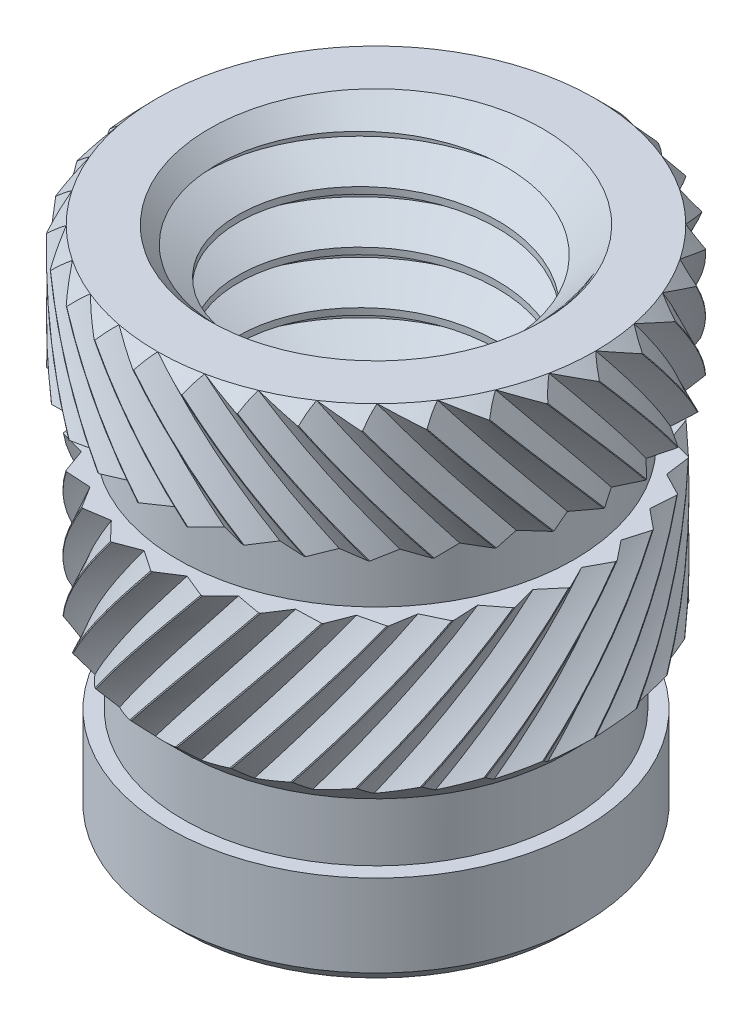
from build123d import *

# Parameters (mm, degrees)
SWEEP1_PITCH           = 0.8
SWEEP1_HEIGHT          = 8.674
SWEEP1_RADIUS          = 2.5
SWEEP1_START_ANGLE     = 90
SPLIT1_SURFACE_1_BACK  = 13.773
SPLIT1_SURFACE_1_DEPTH = 27.546
SPLIT1_SURFACE_2_BACK  = 13.773
SPLIT1_SURFACE_2_DEPTH = 27.546
CUT_SWEEP1_PITCH       = 25.9842
CIRPATTERN1_COUNT      = 30
CUT_SWEEP2_PITCH       = 25.9842
CIRPATTERN2_COUNT      = 32


with BuildPart() as part:
    # Sketch2 → Revolve1 (revolve)
    with BuildSketch(Plane.XY):
        Polygon((2.5, 3.937), (3.556, 3.937), (3.556, 2.00787), (3.0226, 2.00787), (3.0226, 1.02362), (3.3782, 1.02362), (3.3782, -1.12963325), (2.93303325, -1.5748), (2.93303325, -2.460625), (3.1623, -2.460625), (3.1623, -3.71554375), (2.94084375, -3.937), (2.5, -3.937), align=None)
    revolve(axis=Axis((0, -3.937, 0), (0, 1, 0)))

    # Sketch14 → Cut-Revolve2 (revolve, cut)
    with BuildSketch(Plane.XY):
        Polygon((3.34264, 3.937), (3.76936, 3.937), (3.556, 3.72364), align=None)
    revolve(axis=Axis((0, -3.937, 0), (0, 1, 0)), mode=Mode.SUBTRACT)

    # Sweep1: sweep along a helix
    with BuildLine() as sweep1_path:
        add(Helix(SWEEP1_PITCH, SWEEP1_HEIGHT, SWEEP1_RADIUS, center=(0, 3.937, 0), direction=(0, -1, 0), mode=Mode.PRIVATE).rotate(Axis((0, 3.937, 0), (0, -1, 0)), SWEEP1_START_ANGLE))
    # Sketch5 → Sweep1 (sweep)
    with BuildSketch(Plane.XY):
        Polygon((1.980384758, 4.237), (1.980384758, 4.337), (2.54330127, 4.662), (2.54330127, 3.912), align=None)
    sweep(path=sweep1_path.line, is_frenet=True)

    # Sketch6 → Cut-Revolve1 (revolve, cut)
    with BuildSketch(Plane.XY, mode=Mode.PRIVATE) as cut_revolve1_sk:
        Polygon((2.58660254, 4.687), (2.58660254, 3.937), (2.54330127, 3.937), (1.893782217, 3.287480947), (1.893782217, 4.687), align=None)
        Polygon((1.893782217, -3.287480947), (1.893782217, -4.687), (1.893782217, -5.537), (2.58660254, -5.537), (2.58660254, -4.687), (2.58660254, -3.937), (2.54330127, -3.937), align=None)
    revolve(cut_revolve1_sk.sketch.rotate(Axis((0, 3.937, 0), (0, -1, 0)), 292.061472807), axis=Axis((0, 3.937, 0), (0, -1, 0)), mode=Mode.SUBTRACT)


with BuildPart() as body_2:
    # Split1: the piece behind the surface
    add(part.part)
    # Split1 surface: a surface, the sketch's curves swept straight by 27.546 mm
    with BuildLine(Plane.XY.offset(-SPLIT1_SURFACE_1_BACK), mode=Mode.PRIVATE) as split1_surface_1_path:
        Line((-3.556, -1.5748), (3.556, -1.5748))
    split1_surface_1 = Shell.extrude(split1_surface_1_path.wire(), (0 * SPLIT1_SURFACE_1_DEPTH, 0 * SPLIT1_SURFACE_1_DEPTH, 1 * SPLIT1_SURFACE_1_DEPTH))
    split(bisect_by=split1_surface_1, keep=Keep.BOTTOM)


with BuildPart() as part_1:
    add(part.part)

    # Split1: split by a surface, the side it looks to stays
    # Split1 surface: a surface, the sketch's curves swept straight by 27.546 mm
    with BuildLine(Plane.XY.offset(-SPLIT1_SURFACE_2_BACK), mode=Mode.PRIVATE) as split1_surface_2_path:
        Line((-3.556, -1.5748), (3.556, -1.5748))
    split1_surface_2 = Shell.extrude(split1_surface_2_path.wire(), (0 * SPLIT1_SURFACE_2_DEPTH, 0 * SPLIT1_SURFACE_2_DEPTH, 1 * SPLIT1_SURFACE_2_DEPTH))
    split(bisect_by=split1_surface_2, keep=Keep.TOP)

    # Cut-Sweep1: arcs per turn and ends read off the stored shape
    # Cut-Sweep1: the profile of Sketch9 screwed along a right-hand helix through 0.2 turns, 22 arcs to a turn; built about Z, then put on its axis
    cut_sweep1_z = Axis((0, 0, 0), (0, 0, 1))
    cut_sweep1_corners = [(3.18262, 0, 0), (3.360812766, -0.342305118, 0), (3.360812766, 0.342305118, 0)]
    with BuildLine(mode=Mode.PRIVATE) as cut_sweep1_profile:
        Line(cut_sweep1_corners[0], cut_sweep1_corners[1])
        Line(cut_sweep1_corners[2], cut_sweep1_corners[0])
        ThreePointArc((3.360812766, -0.342305118, 0), (3.3782, 0, 0), (3.360812766, 0.342305118, 0))
    cut_sweep1_cap = Face(cut_sweep1_profile.wire())
    cut_sweep1_arcs = [((3.360812766, -0.342305118, 0), (3.395677188, 0, 0), (3.360812766, 0.342305118, 0), (1, 0.9948531068932419, 1))]  # start, shoulder, end, weights
    cut_sweep1_turn_angles = [0, 8.181818182, 16.363636364, 24.545454545, 32.727272727, 40.909090909, 49.090909091, 57.272727273, 65.454545455, 68.727272727, 72]
    cut_sweep1_turn_weights = [1, 0.9898214418809327, 1, 0.9898214418809327, 1, 0.9898214418809327, 1, 0.9898214418809327, 1, 0.9983691039261356, 1]
    cut_sweep1_turn_rails = [Edge.make_bspline([Vector(p[0], p[1], 0).rotate(cut_sweep1_z, cut_sweep1_turn_angles[k]) / cut_sweep1_turn_weights[k] + Vector(0, 0, p[2] + CUT_SWEEP1_PITCH * cut_sweep1_turn_angles[k] / 360) for k in range(11)], [0, 0, 0, 1, 1, 2, 2, 3, 3, 4, 4, 5, 5, 5], 2, cut_sweep1_turn_weights) for p in cut_sweep1_corners]
    cut_sweep1_turn_sides = [*[Face.make_surface_from_curves(cut_sweep1_turn_rails[p[0]], cut_sweep1_turn_rails[p[1]]) for p in [(0, 1), (2, 0)]], *[Face.make_bezier_surface([[Vector(p[j][0], p[j][1], 0).rotate(cut_sweep1_z, cut_sweep1_turn_angles[2 * i + k]) / cut_sweep1_turn_weights[2 * i + k] + Vector(0, 0, p[j][2] + CUT_SWEEP1_PITCH * cut_sweep1_turn_angles[2 * i + k] / 360) for k in range(3)] for j in range(3)], [[p[3][j] * cut_sweep1_turn_weights[2 * i + k] for k in range(3)] for j in range(3)]) for p in cut_sweep1_arcs for i in range(5)]]
    cut_sweep1 = Plane(origin=(0, 1.515745, 0), x_dir=(0, 0, 1), z_dir=(0, -1, 0)) * Solid(Shell([*cut_sweep1_turn_sides, cut_sweep1_cap, cut_sweep1_cap.rotate(cut_sweep1_z, 72).moved(Location((0, 0, CUT_SWEEP1_PITCH * 72 / 360)))]))
    add(cut_sweep1, mode=Mode.SUBTRACT)

    # CirPattern1: Cut-Sweep1 ×30 about axis
    cirpattern1_axis = Axis((0, -3.937, 0), (0, 1, 0))
    for i in range(1, CIRPATTERN1_COUNT):
        add(cut_sweep1.rotate(cirpattern1_axis, i * 360 / CIRPATTERN1_COUNT), mode=Mode.SUBTRACT)

    # Cut-Sweep2: arcs per turn and ends read off the stored shape
    # Cut-Sweep2: the profile of Sketch13 screwed along a left-hand helix through 0.2 turns, 22 arcs to a turn; built about Z, then put on its axis
    cut_sweep2_z = Axis((0, 0, 0), (0, 0, 1))
    cut_sweep2_corners = [(3.34264, 0, 0), (3.539598561, 0.341142235, 0), (3.539598561, -0.341142235, 0)]
    with BuildLine(mode=Mode.PRIVATE) as cut_sweep2_profile:
        Line(cut_sweep2_corners[0], cut_sweep2_corners[1])
        Line(cut_sweep2_corners[2], cut_sweep2_corners[0])
        ThreePointArc((3.539598561, 0.341142235, 0), (3.556, 0, 0), (3.539598561, -0.341142235, 0))
    cut_sweep2_cap = Face(cut_sweep2_profile.wire())
    cut_sweep2_arcs = [((3.539598561, 0.341142235, 0), (3.572477438, 0, 0), (3.539598561, -0.341142235, 0), (1, 0.9953876719146323, 1))]  # start, shoulder, end, weights
    cut_sweep2_turn_angles = [0, -8.181818182, -16.363636364, -24.545454545, -32.727272727, -40.909090909, -49.090909091, -57.272727273, -65.454545455, -68.727272727, -72]
    cut_sweep2_turn_weights = [1, 0.9898214418809327, 1, 0.9898214418809327, 1, 0.9898214418809327, 1, 0.9898214418809327, 1, 0.9983691039261356, 1]
    cut_sweep2_turn_rails = [Edge.make_bspline([Vector(p[0], p[1], 0).rotate(cut_sweep2_z, cut_sweep2_turn_angles[k]) / cut_sweep2_turn_weights[k] + Vector(0, 0, p[2] + -CUT_SWEEP2_PITCH * cut_sweep2_turn_angles[k] / 360) for k in range(11)], [0, 0, 0, 1, 1, 2, 2, 3, 3, 4, 4, 5, 5, 5], 2, cut_sweep2_turn_weights) for p in cut_sweep2_corners]
    cut_sweep2_turn_sides = [*[Face.make_surface_from_curves(cut_sweep2_turn_rails[p[0]], cut_sweep2_turn_rails[p[1]]) for p in [(0, 1), (2, 0)]], *[Face.make_bezier_surface([[Vector(p[j][0], p[j][1], 0).rotate(cut_sweep2_z, cut_sweep2_turn_angles[2 * i + k]) / cut_sweep2_turn_weights[2 * i + k] + Vector(0, 0, p[j][2] + -CUT_SWEEP2_PITCH * cut_sweep2_turn_angles[2 * i + k] / 360) for k in range(3)] for j in range(3)], [[p[3][j] * cut_sweep2_turn_weights[2 * i + k] for k in range(3)] for j in range(3)]) for p in cut_sweep2_arcs for i in range(5)]]
    cut_sweep2 = Plane(origin=(0, 1.515745, 0), x_dir=(0, 0, 1), z_dir=(0, 1, 0)) * Solid(Shell([*cut_sweep2_turn_sides, cut_sweep2_cap, cut_sweep2_cap.rotate(cut_sweep2_z, -72).moved(Location((0, 0, -CUT_SWEEP2_PITCH * -72 / 360)))]))
    add(cut_sweep2, mode=Mode.SUBTRACT)

    # CirPattern2: Cut-Sweep2 ×32 about axis
    cirpattern2_axis = Axis((0, 3.937, 0), (0, -1, 0))
    for i in range(1, CIRPATTERN2_COUNT):
        add(cut_sweep2.rotate(cirpattern2_axis, i * 360 / CIRPATTERN2_COUNT), mode=Mode.SUBTRACT)

    # Combine1: union body 2
    add(body_2.part)


solid = part_1.part
